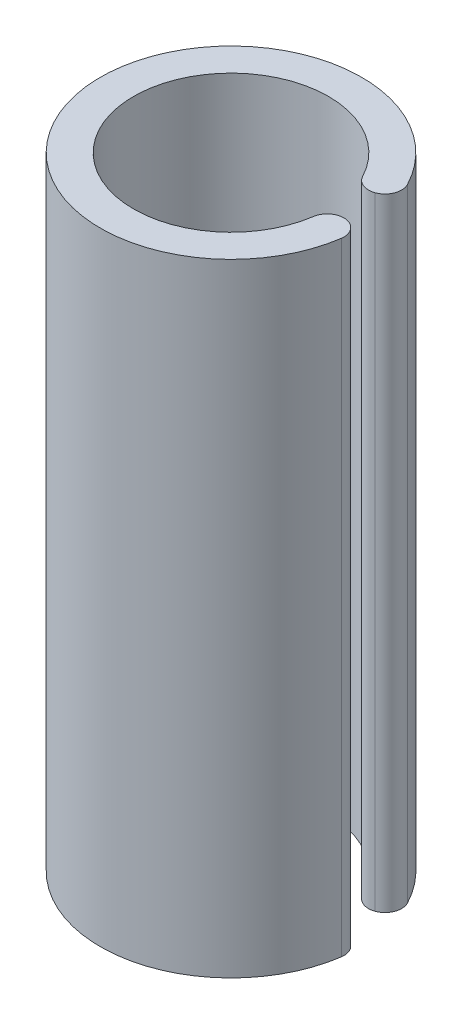
from build123d import *

# Parameters (mm, degrees)
BOSS_EXTRUDE1_DEPTH = 15
FILLET1_R           = 0.4


with BuildPart() as part:
    # Sketch1 → Boss-Extrude1 (new body)
    with BuildSketch(Plane(origin=(0, 0, 0), x_dir=(1, 0, 0), z_dir=(0, 1, 0))):
        with BuildLine():
            Line((2.219557977, 0.772050767), (2.971014846, 1.046695174))
            ThreePointArc((2.971014846, 1.046695174), (-3.104931301, -0.530944082), (3.15, 0))
            Line((3.15, 0), (2.35, 0))
            ThreePointArc((2.35, 0), (-2.317160034, -0.391496331), (2.219557977, 0.772050767))
        make_face()
    extrude(amount=BOSS_EXTRUDE1_DEPTH)

    # Fillet1
    fillet1_edges = [part.edges().sort_by_distance(p)[0] for p in [
        (3.15, 7.5, 0),
        (2.35, 7.5, 0),
        (2.219557977, 7.5, -0.772050767),
        (2.971014846, 7.5, -1.046695174),
    ]]
    fillet(fillet1_edges, radius=FILLET1_R - 0.0001)  # a hair under: the kernel refuses the full size


solid = part.part
